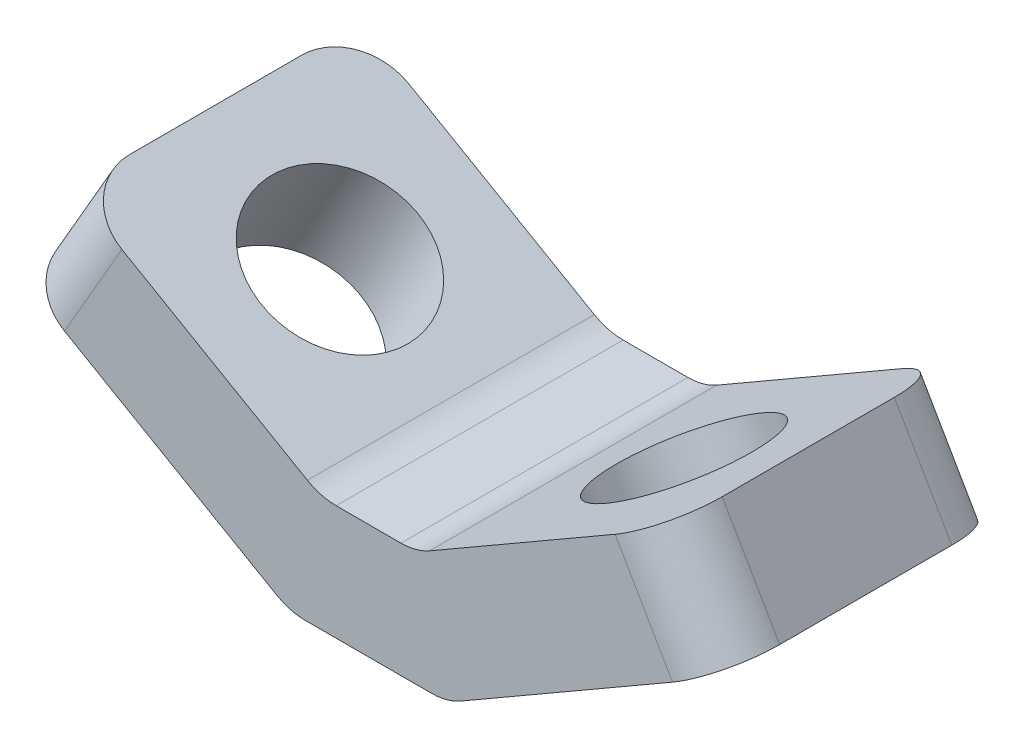
from build123d import *

# Parameters (mm, degrees)
EXTRUDE_1_DEPTH          = 7.5
CUT_EXTRUDE_1_DEPTH      = 28.371025711
CUT_EXTRUDE_1_DEPTH_BACK = 28.371025711
SKETCH_2_R               = 4.1
CUT_EXTRUDE_2_DEPTH      = 28.735701638
CUT_EXTRUDE_2_DEPTH_BACK = 28.735701638
SKETCH_3_R               = 4.1
FILLET_1_R               = 3


with BuildPart() as part:
    # ｽｹｯﾁ1 → ﾎﾞｽ - 押し出し1 (new, symmetric)
    with BuildSketch(Plane.XY):
        Polygon((0, 0), (-14.382685902, 8.303847577), (-11.382685902, 13.5), (1.607695155, 6), (6.607695155, 6), (19.598076211, 13.5), (22.598076211, 8.303847577), (8.215390309, 0), align=None)
    extrude(amount=EXTRUDE_1_DEPTH, both=True)

    # ｽｹｯﾁ2 → ｶｯﾄ - 押し出し1 (cut, two sides: drawn at the far end of the back side and taken through both)
    with BuildSketch(Plane(origin=(0, 0, 0), x_dir=(0, 0, 1), z_dir=(-0.5000000000000012, -0.866025403784438, 0)).offset(-CUT_EXTRUDE_1_DEPTH_BACK)):
        with Locations((0, 9.107695155)):
            Circle(SKETCH_2_R)
    extrude(amount=CUT_EXTRUDE_1_DEPTH + CUT_EXTRUDE_1_DEPTH_BACK, mode=Mode.SUBTRACT)

    # ｽｹｯﾁ3 → ｶｯﾄ - 押し出し2 (cut, two sides: drawn at the far end of the back side and taken through both)
    with BuildSketch(Plane(origin=(2.053847577, -3.557368355, 0), x_dir=(0, 0, -1), z_dir=(0.5000000000000013, -0.8660254037844379, 0)).offset(-CUT_EXTRUDE_2_DEPTH_BACK)):
        with Locations((0, 16.222431864)):
            Circle(SKETCH_3_R)
    extrude(amount=CUT_EXTRUDE_2_DEPTH + CUT_EXTRUDE_2_DEPTH_BACK, mode=Mode.SUBTRACT)

    # ﾌｨﾚｯﾄ1
    fillet_1_edges = [part.edges().sort_by_distance(p)[0] for p in [
        (21.098076211, 10.901923789, -7.5),
        (21.098076211, 10.901923789, 7.5),
        (-12.882685902, 10.901923789, -7.5),
        (-12.882685902, 10.901923789, 7.5),
        (8.215390309, 0, 0),
        (0, 0, 0),
        (6.607695155, 6, 0),
        (1.607695155, 6, 0),
    ]]
    fillet(fillet_1_edges, radius=FILLET_1_R)


solid = part.part
